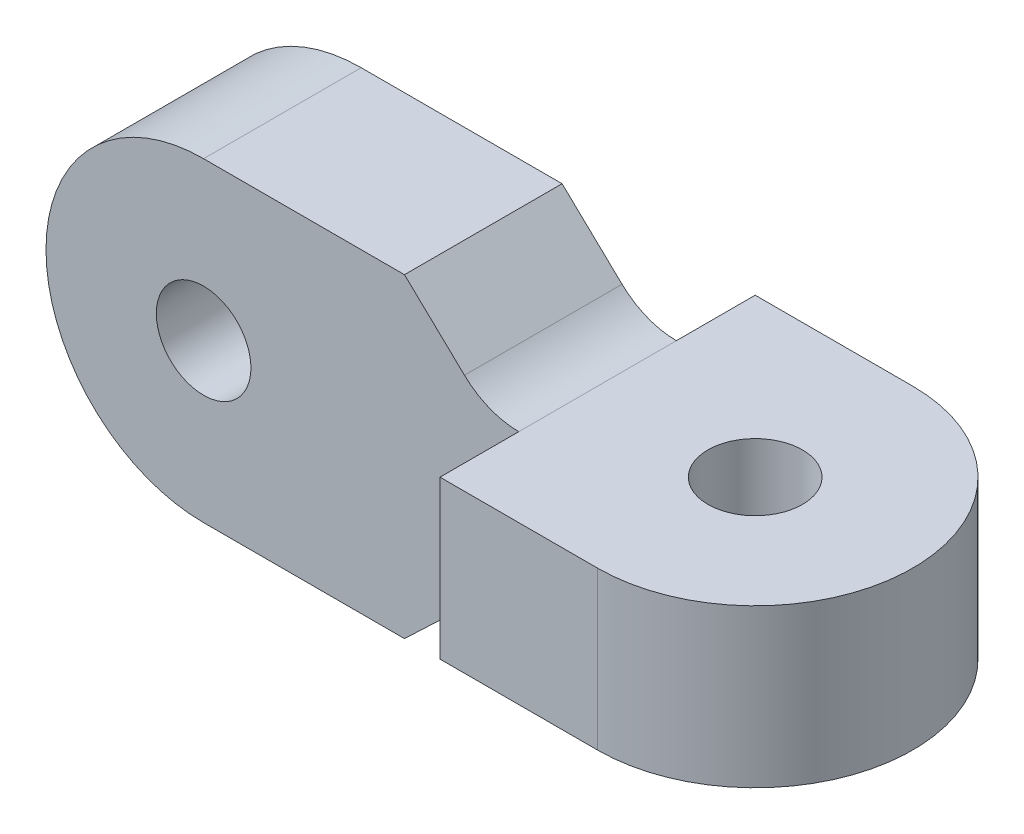
from build123d import *

# Parameters (mm, degrees)
CROQUIS1_R              = 1.5
SALIENTE_EXTRUIR1_DEPTH = 10
CROQUIS2_R              = 1.5
CORTAR_EXTRUIR1_DEPTH   = 10
CROQUIS3_W              = 30
CROQUIS3_H              = 5.454139521
CORTAR_EXTRUIR2_DEPTH   = 10
REDONDEO1_R             = 5
CORTAR_EXTRUIR3_DEPTH   = 10


with BuildPart() as part:
    # Croquis1 → Saliente-Extruir1 (new body)
    with BuildSketch(Plane.XY):
        Polygon((0, 0), (15, 0), (15, 2.5), (25, 2.5), (25, 7.5), (15, 7.5), (15, 10), (0, 10), align=None)
        with Locations((5, 5)):
            Circle(CROQUIS1_R, mode=Mode.SUBTRACT)
    extrude(amount=SALIENTE_EXTRUIR1_DEPTH)

    # Croquis2 → Cortar-Extruir1 (cut)
    with BuildSketch(Plane(origin=(0, 7.5, 0), x_dir=(1, 0, 0), z_dir=(0, 1, 0))):
        with Locations(Location((20, -5, 0), (0, 0, 270))):
            Circle(CROQUIS2_R)
        with BuildLine():
            Line((20, -10), (20.922664414, -18.434540281))
            Line((20.922664414, -18.434540281), (42.481308924, -25.135304993))
            Line((42.481308924, -25.135304993), (36.797179784, -0.604681732))
            Line((36.797179784, -0.604681732), (34.226694382, 7.989532519))
            Line((34.226694382, 7.989532519), (20.461332207, 6.483723144))
            Line((20.461332207, 6.483723144), (20, 0))
            ThreePointArc((20, 0), (25, -5), (20, -10))
        make_face()
    extrude(amount=-CORTAR_EXTRUIR1_DEPTH, mode=Mode.SUBTRACT)

    # Croquis3 → Cortar-Extruir2 (cut)
    with BuildSketch(Plane(origin=(0, 10, 0), x_dir=(1, 0, 0), z_dir=(0, 1, 0))):
        with Locations((0, -10.227069761)):
            Rectangle(CROQUIS3_W, CROQUIS3_H)
        with Locations((0, 0.227069761)):
            Rectangle(CROQUIS3_W, CROQUIS3_H)
    extrude(amount=-CORTAR_EXTRUIR2_DEPTH, mode=Mode.SUBTRACT)

    # Redondeo1
    redondeo1_edges = [part.edges().sort_by_distance(p)[0] for p in [
        (0, 0, 5),
        (0, 10, 5),
    ]]
    fillet(redondeo1_edges, radius=REDONDEO1_R - 0.0001)  # a hair under: the kernel refuses the full size

    # Croquis4 → Cortar-Extruir3 (cut)
    with BuildSketch(Plane.XY.offset(7.5)):
        with BuildLine():
            Line((13.276608017, 8.188945039), (11.373430966, 10))
            Line((11.373430966, 10), (13.276608017, 11.811054961))
            ThreePointArc((13.276608017, 11.811054961), (17.5, 10), (13.276608017, 8.188945039))
        make_face()
        with BuildLine():
            Line((13.276608017, 1.811054961), (11.373430966, 0))
            Line((11.373430966, 0), (13.276608017, -1.811054961))
            ThreePointArc((13.276608017, -1.811054961), (17.5, 0), (13.276608017, 1.811054961))
        make_face()
    extrude(amount=-CORTAR_EXTRUIR3_DEPTH, mode=Mode.SUBTRACT)


solid = part.part
